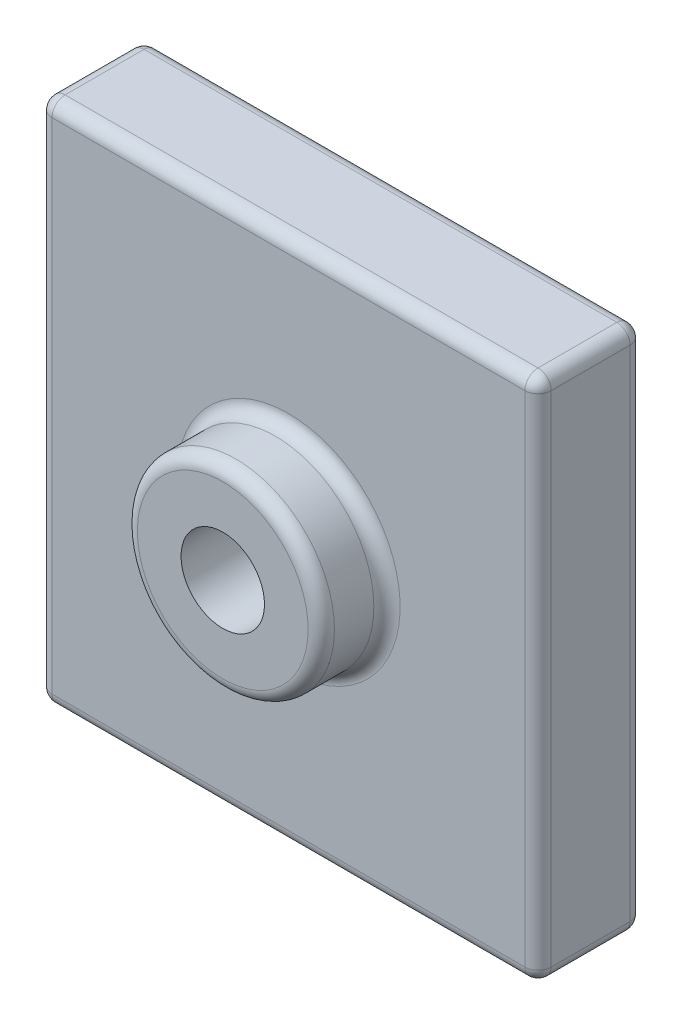
from build123d import *
from build123d.topology import SkipClean

# Parameters (mm, degrees)
SKETCH1_W           = 38
SKETCH1_H           = 40
BOSS_EXTRUDE1_DEPTH = 8
SKETCH2_R           = 7.5
SKETCH2_R_2         = 3.175
BOSS_EXTRUDE2_DEPTH = 5
FILLET1_R           = 1
CUT_EXTRUDE1_DEPTH  = 5.55625
SKETCH4_R           = 3.175
CUT_EXTRUDE2_DEPTH  = 57.683330883


with BuildPart() as part:
    # Sketch1 → Boss-Extrude1 (new body)
    with BuildSketch(Plane.XY):
        with Locations((19, 20)):
            Rectangle(SKETCH1_W, SKETCH1_H)
    extrude(amount=BOSS_EXTRUDE1_DEPTH)

    # Sketch2 → Boss-Extrude2 (add)
    with BuildSketch(Plane.XY.offset(8)):
        with Locations((19, 20)):
            Circle(SKETCH2_R)
        with Locations((19, 20)):
            Circle(SKETCH2_R_2, mode=Mode.SUBTRACT)
    extrude(amount=BOSS_EXTRUDE2_DEPTH)

    # Fillet1
    fillet1_edges = [part.edges().sort_by_distance(p)[0] for p in [
        (11.5, 20, 13),
        (19, 0, 0),
        (19, 40, 0),
        (38, 0, 4),
        (38, 40, 4),
        (38, 20, 0),
        (0, 40, 4),
        (0, 0, 4),
        (0, 20, 0),
        (11.5, 20, 8),
        (19, 40, 8),
        (38, 20, 8),
        (19, 0, 8),
        (0, 20, 8),
    ]]
    fillet(fillet1_edges, radius=FILLET1_R)

    # Sketch3 → Cut-Extrude1 (cut)
    with BuildSketch(Plane(origin=(0, 0, 0), x_dir=(-1, 0, 0), z_dir=(0, 0, -1))):
        Polygon((-15.792097567, 25.55625), (-22.207902433, 25.55625), (-25.415804866, 20), (-22.207902433, 14.44375), (-15.792097567, 14.44375), (-12.584195134, 20), align=None)
    extrude(amount=-CUT_EXTRUDE1_DEPTH, mode=Mode.SUBTRACT)

    # Sketch4 → Cut-Extrude2 (cut, through all)
    with SkipClean():  # the faces are left unmerged after this step: merging them gives an invalid solid
        with BuildSketch(Plane(origin=(0, 0, 0), x_dir=(-1, 0, 0), z_dir=(0, 0, -1))):
            with Locations((-19, 20)):
                Circle(SKETCH4_R)
        extrude(amount=-CUT_EXTRUDE2_DEPTH, mode=Mode.SUBTRACT)


solid = part.part
